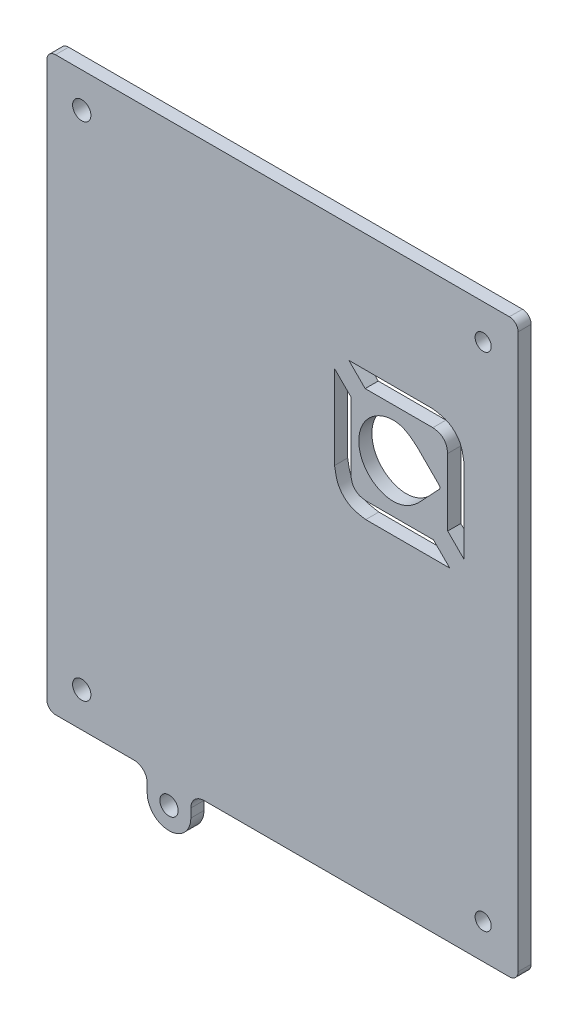
from build123d import *

# Parameters (mm, degrees)
SKETCH2_R           = 2.1
SKETCH2_R_2         = 1.85
BOSS_EXTRUDE1_DEPTH = 3
FILLET1_R           = 2
FILLET2_R           = 3
CUT_EXTRUDE2_DEPTH  = 10


with BuildPart() as part:
    # Sketch2 → Boss-Extrude1 (new body)
    with BuildSketch(Plane.XY):
        with BuildLine():
            Line((0.167188, 159.1806075), (0.167188, 28.18105))
            Line((0.167188, 28.18105), (23.16763175, 28.18105))
            Line((23.16763175, 28.18105), (23.16763175, 23.18105))
            ThreePointArc((23.16763175, 23.18105), (28.16763175, 18.18105), (33.16763175, 23.18105))
            Line((33.16763175, 23.18105), (33.16763175, 28.18105))
            Line((33.16763175, 28.18105), (108.16728925, 28.18105))
            Line((108.16728925, 28.18105), (108.16728925, 159.1806075))
            Line((108.16728925, 159.1806075), (0.167188, 159.1806075))
        make_face()
        with Locations((8.16763175, 151.180160625)):
            Circle(SKETCH2_R, mode=Mode.SUBTRACT)
        with Locations((100.1668405, 151.180160625)):
            Circle(SKETCH2_R_2, mode=Mode.SUBTRACT)
        with Locations((100.1668405, 36.181495)):
            Circle(SKETCH2_R_2, mode=Mode.SUBTRACT)
        with Locations((8.16763175, 36.181495)):
            Circle(SKETCH2_R, mode=Mode.SUBTRACT)
        with Locations((28.16763175, 23.18105)):
            Circle(SKETCH2_R, mode=Mode.SUBTRACT)
    extrude(amount=BOSS_EXTRUDE1_DEPTH)

    # Fillet1
    fillet1_edges = [part.edges().sort_by_distance(p)[0] for p in [
        (0.167188, 159.1806075, 1.5),
        (0.167188, 28.18105, 1.5),
        (108.16728925, 159.1806075, 1.5),
        (108.16728925, 28.18105, 1.5),
    ]]
    fillet(fillet1_edges, radius=FILLET1_R)

    # Fillet2
    fillet2_edges = [part.edges().sort_by_distance(p)[0] for p in [
        (33.16763175, 28.18105, 1.5),
        (23.16763175, 28.18105, 1.5),
    ]]
    fillet(fillet2_edges, radius=FILLET2_R)

    # Sketch4 → Cut-Extrude2 (cut)
    with BuildSketch(Plane.XY.offset(3)):
        with BuildLine():
            Line((90.075646506, 117.73200384), (85.222492213, 122.585440133))
            add(Edge.make_bspline(
                [(85.222492213, 122.585440133), (85.218321654, 122.589906475), (85.210156188, 122.598651052), (85.197690329, 122.611053384), (84.691367809, 123.069531987), (83.646020439, 123.962968104), (81.841639807, 125.063143289), (79.018689145, 125.620925084), (75.483429729, 124.578659546), (72.421413203, 121.511054212), (71.277969143, 117.291105556), (72.419134253, 113.074163455), (75.48745008, 110.019129617), (79.007939308, 109.010493093), (81.802978771, 109.52107185), (83.67661258, 110.4349626), (84.719062278, 111.308613745), (85.222492213, 111.730525843)],
                knots=[0, 0, 0, 0, 0.000489092, 0.000957584, 0.001406885, 0.055155152, 0.111026991, 0.168427122, 0.280644353, 0.389809521, 0.502189722, 0.614354085, 0.723170681, 0.835316449, 0.891384032, 0.947546121, 1, 1, 1, 1], degree=3))
            Line((85.222492213, 111.730525843), (90.075646506, 116.880365543))
            add(Edge.make_bspline(
                [(90.075646506, 116.880365543), (90.109522307, 116.919500688), (90.176474931, 116.996847955), (90.245739585, 117.136575977), (90.255561269, 117.2376526), (90.260467137, 117.288139727)],
                knots=[0, 0, 0, 0, 0.338885039, 0.6697773, 1, 1, 1, 1], degree=3))
            add(Edge.make_bspline(
                [(90.260467137, 117.288139727), (90.255380779, 117.340773367), (90.244905857, 117.449167875), (90.181107379, 117.60340029), (90.110615752, 117.68936083), (90.075646506, 117.73200384)],
                knots=[0, 0, 0, 0, 0.322338023, 0.663827768, 1, 1, 1, 1], degree=3))
        make_face()
        with BuildLine():
            Line((92.042378573, 124.994238315), (92.042378573, 109.584429825))
            Line((92.042378573, 109.584429825), (95.783616091, 105.843329069))
            Line((95.783616091, 105.843329069), (95.783616091, 124.994238315))
            add(Edge.make_bspline(
                [(95.783616091, 124.994238315), (95.584086694, 126.243116762), (95.190094605, 128.709160539), (92.349609853, 131.549706455), (89.883262985, 131.943682776), (88.63409439, 132.143226017)],
                knots=[0, 0, 0, 0, 0.336153842, 0.663771636, 1, 1, 1, 1], degree=3))
            Line((88.63409439, 132.143226017), (71.146969364, 132.14181502))
            Line((71.146969364, 132.14181502), (69.382500142, 132.14181502))
            Line((69.382500142, 132.14181502), (73.124981387, 128.401052265))
            Line((73.124981387, 128.401052265), (88.63409439, 128.4019945))
            add(Edge.make_bspline(
                [(88.63409439, 128.4019945), (89.238028731, 128.313763765), (90.41836548, 128.141324525), (91.78142027, 126.779337794), (91.954033553, 125.598567235), (92.042378573, 124.994238315)],
                knots=[0, 0, 0, 0, 0.338409749, 0.6613922, 1, 1, 1, 1], degree=3))
        make_face()
        with BuildLine():
            Line((69.847337963, 109.618131067), (69.869724846, 125.105890927))
            Line((69.869724846, 125.105890927), (66.126740058, 128.848124639))
            Line((66.126740058, 128.848124639), (66.104734448, 109.618131067))
            add(Edge.make_bspline(
                [(66.104734448, 109.618131067), (66.304386896, 108.36912039), (66.698639033, 105.902708716), (69.539445064, 103.061623579), (72.006219889, 102.668063373), (73.255483147, 102.468750366)],
                knots=[0, 0, 0, 0, 0.336156644, 0.663805911, 1, 1, 1, 1], degree=3))
            Line((73.255483147, 102.468750366), (92.509854719, 102.470304078))
            Line((92.509854719, 102.470304078), (88.768346075, 106.211061941))
            Line((88.768346075, 106.211061941), (73.255483147, 106.210236883))
            add(Edge.make_bspline(
                [(73.255483147, 106.210236883), (72.651391524, 106.298170044), (71.470770397, 106.470024352), (70.108075627, 107.832856289), (69.935611441, 109.013721212), (69.847337963, 109.618131067)],
                knots=[0, 0, 0, 0, 0.33840601, 0.661371999, 1, 1, 1, 1], degree=3))
        make_face()
    extrude(amount=-CUT_EXTRUDE2_DEPTH, mode=Mode.SUBTRACT)


solid = part.part
